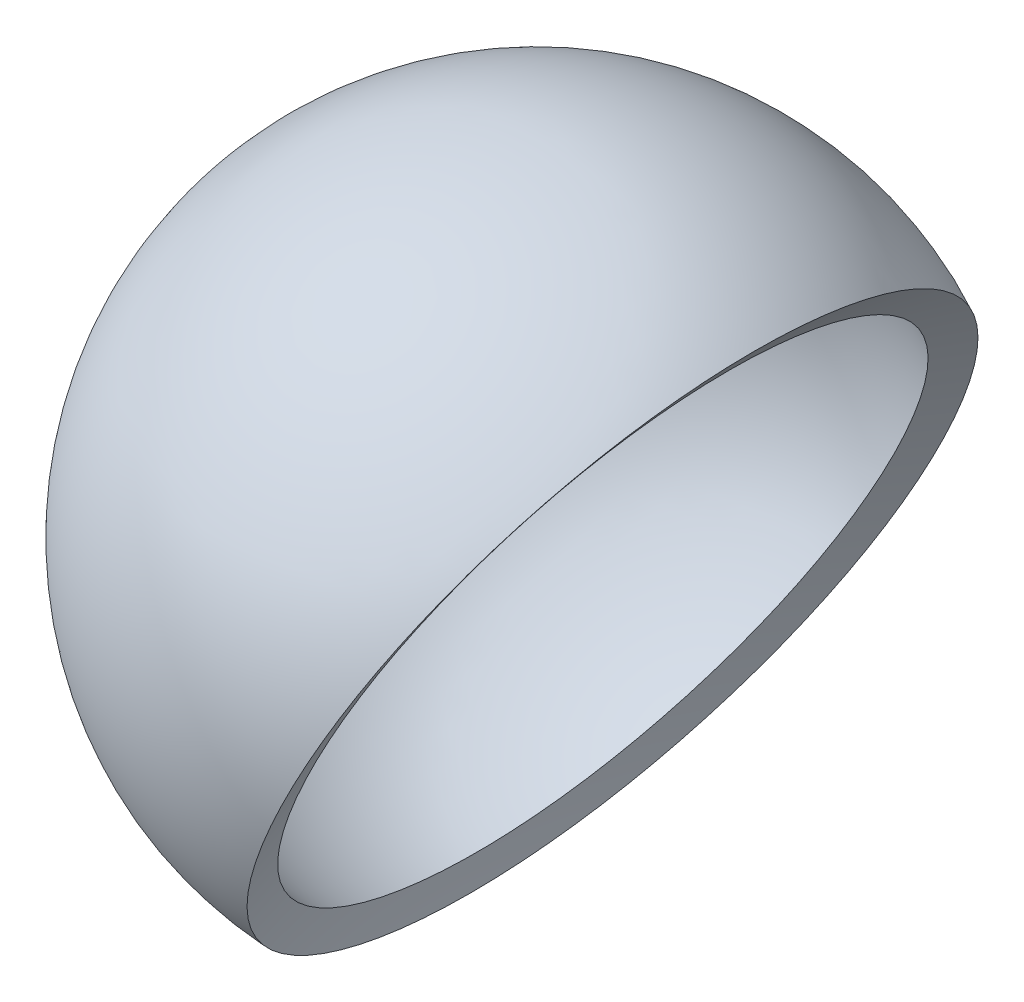
from build123d import *
from build123d.topology import SkipClean


with BuildPart() as part:
    # Sketch1 → Revolve1 (revolve)
    with BuildSketch(Plane.XY):
        with BuildLine():
            ThreePointArc((0, 45), (-45, 0), (0, -45))
            Line((0, -45), (0, -40))
            ThreePointArc((0, -40), (-40, 0), (0, 40))
            Line((0, 40), (0, 45))
        make_face()
    revolve(axis=Axis((0, -45, 0), (0, 1, 0)))

    # Sketch2 → Cut-Revolve2 (revolve, cut)
    with SkipClean():  # the faces are left unmerged after this step: merging them gives an invalid solid
        with BuildSketch(Plane.XY):
            with BuildLine():
                Line((140, -65), (140, 85))
                ThreePointArc((140, 85), (-10, -65), (140, -215))
                Line((140, -215), (140, -65))
            make_face()
        revolve(axis=Axis((140, -65, 0), (0, 1, 0)), mode=Mode.SUBTRACT)


solid = part.part
